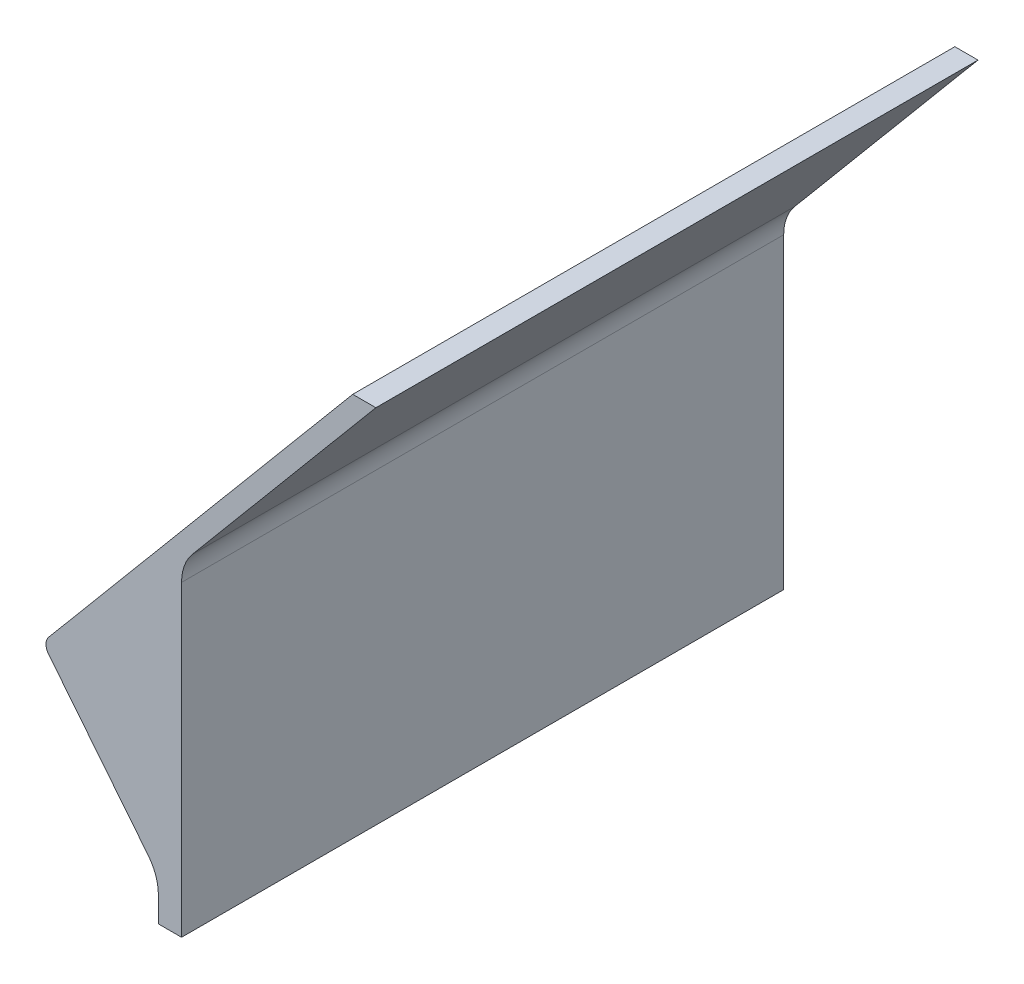
from build123d import *

# Parameters (mm, degrees)
FUNNEL_RIGHT_SIDE_DEPTH = 130
FILLET2_R               = 10
FILLET3_R               = 2.5


with BuildPart() as part:
    # Sketch1 → Funnel - Right Side (new body)
    with BuildSketch(Plane.XY):
        Polygon((0, 0), (0, 70), (41.954981559, 120), (36.954981559, 120), (-30, 40.206160185), (-5, 8.981170193), (-5, 0), align=None)
    extrude(amount=FUNNEL_RIGHT_SIDE_DEPTH)

    # Fillet2
    fillet2_edges = [part.edges().sort_by_distance(p)[0] for p in [
        (0, 70, 65),
        (-5, 8.981170193, 65),
    ]]
    fillet(fillet2_edges, radius=FILLET2_R)

    # Fillet3
    fillet3_edges = [part.edges().sort_by_distance(p)[0] for p in [
        (-30, 40.206160185, 65),
    ]]
    fillet(fillet3_edges, radius=FILLET3_R)


solid = part.part
